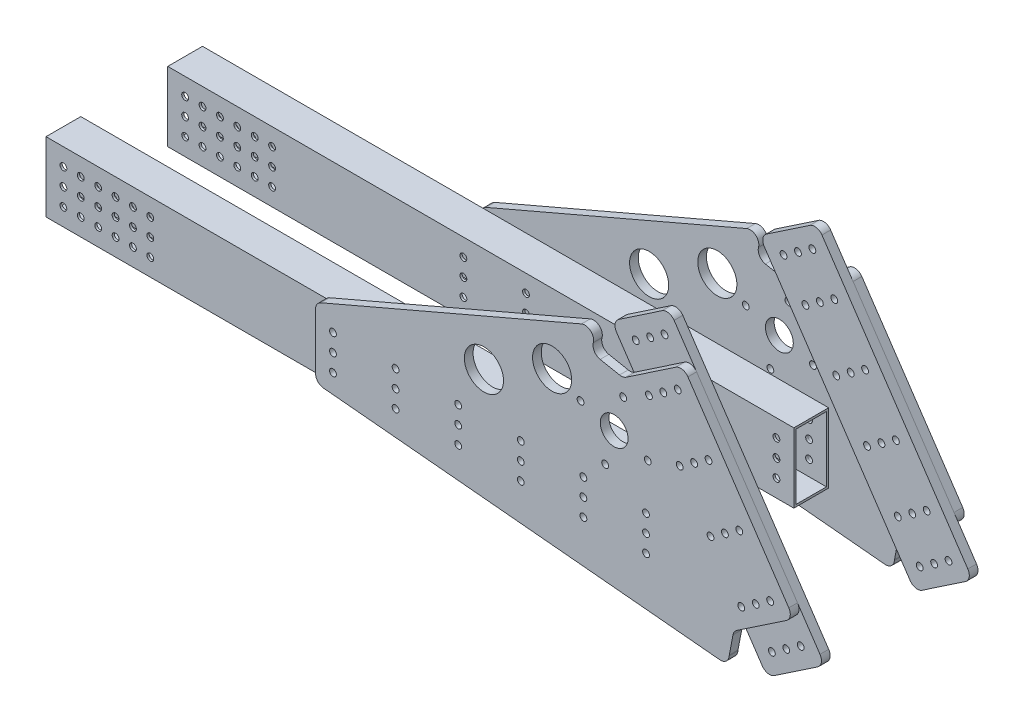
from build123d import *

# Parameters (mm, degrees)
BEARING_BLOCK_INTERFACE_PLATE_R = 2.4892
BOSS_EXTRUDE1_DEPTH             = 6.35
FILLET2_R                       = 6.35
PLATE_GB_R                      = 2.4892
PLATE_GB_R_2                    = 14.2875
PLATE_GB_R_3                    = 10.16
BOSS_EXTRUDE2_DEPTH             = 6.35
FILLET1_R                       = 6.35
TUBE_W                          = 457.2
TUBE_H                          = 50.8
BOSS_EXTRUDE3_DEPTH             = 25.4
SHELL2_T                        = -1.5875
TUBE_4_R                        = 2.4892
CUT_EXTRUDE2_DEPTH              = 773.869762832
SKETCH10_R                      = 2.4892
CUT_EXTRUDE3_DEPTH              = 774.104503156


with BuildPart() as part:
    # bearing block interface plate → Boss-Extrude1 (new body)
    with BuildSketch(Plane.XY.offset(57.15)):
        Polygon((529.051437766, 336.148394668), (571.166546451, 364.555394164), (684.794544436, 196.094959421), (642.679435751, 167.687959925), align=None)
        with Locations((646.106463048, 185.31848697)):
            Circle(BEARING_BLOCK_INTERFACE_PLATE_R, mode=Mode.SUBTRACT)
        with Locations((656.635240219, 192.420236844)):
            Circle(BEARING_BLOCK_INTERFACE_PLATE_R, mode=Mode.SUBTRACT)
        with Locations((667.164017391, 199.521986718)):
            Circle(BEARING_BLOCK_INTERFACE_PLATE_R, mode=Mode.SUBTRACT)
        with Locations((567.739519154, 346.924867119)):
            Circle(BEARING_BLOCK_INTERFACE_PLATE_R, mode=Mode.SUBTRACT)
        with Locations((557.210741982, 339.823117245)):
            Circle(BEARING_BLOCK_INTERFACE_PLATE_R, mode=Mode.SUBTRACT)
        with Locations((546.681964811, 332.721367371)):
            Circle(BEARING_BLOCK_INTERFACE_PLATE_R, mode=Mode.SUBTRACT)
        with Locations((562.660902028, 309.031618735)):
            Circle(BEARING_BLOCK_INTERFACE_PLATE_R, mode=Mode.SUBTRACT)
        with Locations((573.189679199, 316.133368609)):
            Circle(BEARING_BLOCK_INTERFACE_PLATE_R, mode=Mode.SUBTRACT)
        with Locations((583.71845637, 323.235118483)):
            Circle(BEARING_BLOCK_INTERFACE_PLATE_R, mode=Mode.SUBTRACT)
        with Locations((606.207330972, 289.893990773)):
            Circle(BEARING_BLOCK_INTERFACE_PLATE_R, mode=Mode.SUBTRACT)
        with Locations((595.6785538, 282.792240899)):
            Circle(BEARING_BLOCK_INTERFACE_PLATE_R, mode=Mode.SUBTRACT)
        with Locations((585.149776629, 275.690491025)):
            Circle(BEARING_BLOCK_INTERFACE_PLATE_R, mode=Mode.SUBTRACT)
        with Locations((628.696205573, 256.552863064)):
            Circle(BEARING_BLOCK_INTERFACE_PLATE_R, mode=Mode.SUBTRACT)
        with Locations((618.167428402, 249.45111319)):
            Circle(BEARING_BLOCK_INTERFACE_PLATE_R, mode=Mode.SUBTRACT)
        with Locations((607.63865123, 242.349363316)):
            Circle(BEARING_BLOCK_INTERFACE_PLATE_R, mode=Mode.SUBTRACT)
        with Locations((651.185080174, 223.211735354)):
            Circle(BEARING_BLOCK_INTERFACE_PLATE_R, mode=Mode.SUBTRACT)
        with Locations((640.656303003, 216.10998548)):
            Circle(BEARING_BLOCK_INTERFACE_PLATE_R, mode=Mode.SUBTRACT)
        with Locations((630.127525831, 209.008235606)):
            Circle(BEARING_BLOCK_INTERFACE_PLATE_R, mode=Mode.SUBTRACT)
    extrude(amount=-BOSS_EXTRUDE1_DEPTH)

    # Fillet2
    fillet2_edges = [part.edges().sort_by_distance(p)[0] for p in [
        (642.679435751, 167.687959925, 53.975),
        (571.166546451, 364.555394164, 53.975),
        (529.051437766, 336.148394668, 53.975),
        (684.794544436, 196.094959421, 53.975),
    ]]
    fillet(fillet2_edges, radius=FILLET2_R)


with BuildPart() as body_2:
    # plate+gb → Boss-Extrude2 (new body)
    with BuildSketch(Plane.XY.offset(63.5)):
        with BuildLine():
            Line((319.237342332, 246.126), (319.237342332, 195.326))
            Line((319.237342332, 195.326), (627.129512771, 166.477179286))
            ThreePointArc((627.129512771, 166.477179286), (622.555505171, 169.035259751), (621.371649855, 174.140532299))
            Line((621.371649855, 174.140532299), (623.889276442, 187.327918834))
            Line((623.889276442, 187.327918834), (624.075421765, 188.302952357))
            ThreePointArc((624.075421765, 188.302952357), (625.011743382, 190.608109349), (626.761896857, 192.376557749))
            Line((626.761896857, 192.376557749), (668.371747852, 220.44275663))
            Line((668.371747852, 220.44275663), (587.589343035, 340.207596955))
            Line((587.589343035, 340.207596955), (545.979492039, 312.141398074))
            ThreePointArc((545.979492039, 312.141398074), (543.684196204, 311.18115646), (541.196139608, 311.176541181))
            Line((541.196139608, 311.176541181), (540.222373002, 311.36920423))
            Line((540.222373002, 311.36920423), (527.052121603, 313.974983453))
            ThreePointArc((527.052121603, 313.974983453), (522.79804256, 316.926147758), (522.065562756, 322.05157775))
            ThreePointArc((522.065562756, 322.05157775), (520.117459336, 328.526714762), (513.437327672, 329.574735381))
            Line((513.437327672, 329.574735381), (319.237342332, 246.126))
        make_face()
        with Locations((630.127525831, 209.008235606)):
            Circle(PLATE_GB_R, mode=Mode.SUBTRACT)
        with Locations((530.703105922, 249.453949879)):
            Circle(PLATE_GB_R, mode=Mode.SUBTRACT)
        with Locations((640.656303003, 216.10998548)):
            Circle(PLATE_GB_R, mode=Mode.SUBTRACT)
        with Locations((651.185080174, 223.211735354)):
            Circle(PLATE_GB_R, mode=Mode.SUBTRACT)
        with Locations((607.63865123, 242.349363316)):
            Circle(PLATE_GB_R, mode=Mode.SUBTRACT)
        with Locations((618.167428402, 249.45111319)):
            Circle(PLATE_GB_R, mode=Mode.SUBTRACT)
        with Locations((442.183710758, 265.176)):
            Circle(PLATE_GB_R_2, mode=Mode.SUBTRACT)
        with Locations((491.957342332, 290.576)):
            Circle(PLATE_GB_R_2, mode=Mode.SUBTRACT)
        with Locations((537.277109667, 273.988465867)):
            Circle(PLATE_GB_R_3, mode=Mode.SUBTRACT)
        with Locations((561.811625655, 267.414462121)):
            Circle(PLATE_GB_R, mode=Mode.SUBTRACT)
        with Locations((512.74259368, 280.562469612)):
            Circle(PLATE_GB_R, mode=Mode.SUBTRACT)
        with Locations((628.696205573, 256.552863064)):
            Circle(PLATE_GB_R, mode=Mode.SUBTRACT)
        with Locations((585.149776629, 275.690491025)):
            Circle(PLATE_GB_R, mode=Mode.SUBTRACT)
        with Locations((595.6785538, 282.792240899)):
            Circle(PLATE_GB_R, mode=Mode.SUBTRACT)
        with Locations((606.207330972, 289.893990773)):
            Circle(PLATE_GB_R, mode=Mode.SUBTRACT)
        with Locations((543.851113413, 298.522981854)):
            Circle(PLATE_GB_R, mode=Mode.SUBTRACT)
        with Locations((562.660902028, 309.031618735)):
            Circle(PLATE_GB_R, mode=Mode.SUBTRACT)
        with Locations((573.189679199, 316.133368609)):
            Circle(PLATE_GB_R, mode=Mode.SUBTRACT)
        with Locations((583.71845637, 323.235118483)):
            Circle(PLATE_GB_R, mode=Mode.SUBTRACT)
    extrude(amount=-BOSS_EXTRUDE2_DEPTH)

    # Fillet1
    fillet1_edges = [body_2.edges().sort_by_distance(p)[0] for p in [
        (668.371747852, 220.44275663, 60.325),
        (587.589343035, 340.207596955, 60.325),
        (319.237342332, 246.126, 60.325),
        (319.237342332, 195.326, 60.325),
        (627.129512771, 166.477179286, 60.325),
    ]]
    fillet(fillet1_edges, radius=FILLET1_R)

    # Sketch10 → Cut-Extrude3 (cut, through all)
    with BuildSketch(Plane.XY.offset(63.5)):
        with Locations((469.097342332, 208.026)):
            Circle(SKETCH10_R)
        with Locations((423.377342332, 208.026)):
            Circle(SKETCH10_R)
        with Locations((377.657342332, 208.026)):
            Circle(SKETCH10_R)
        with Locations((331.937342332, 208.026)):
            Circle(SKETCH10_R)
        with Locations((331.937342332, 220.726)):
            Circle(SKETCH10_R)
        with Locations((377.657342332, 220.726)):
            Circle(SKETCH10_R)
        with Locations((423.377342332, 220.726)):
            Circle(SKETCH10_R)
        with Locations((469.097342332, 220.726)):
            Circle(SKETCH10_R)
        with Locations((514.817342332, 220.726)):
            Circle(SKETCH10_R)
        with Locations((514.817342332, 208.026)):
            Circle(SKETCH10_R)
        with Locations((560.537342332, 208.026)):
            Circle(SKETCH10_R)
        with Locations((560.537342332, 220.726)):
            Circle(SKETCH10_R)
        with Locations((560.537342332, 233.426)):
            Circle(SKETCH10_R)
        with Locations((514.817342332, 233.426)):
            Circle(SKETCH10_R)
        with Locations((469.097342332, 233.426)):
            Circle(SKETCH10_R)
        with Locations((423.377342332, 233.426)):
            Circle(SKETCH10_R)
        with Locations((377.657342332, 233.426)):
            Circle(SKETCH10_R)
        with Locations((331.937342332, 233.426)):
            Circle(SKETCH10_R)
    extrude(amount=-CUT_EXTRUDE3_DEPTH, mode=Mode.SUBTRACT)


with BuildPart() as body_3:
    # tube → Boss-Extrude3 (new body)
    with BuildSketch(Plane.XY.offset(57.15)):
        with Locations((344.637342332, 220.726)):
            Rectangle(TUBE_W, TUBE_H)
    extrude(amount=-BOSS_EXTRUDE3_DEPTH)

    # Shell2
    shell2_openings = [body_3.faces().sort_by_distance(p)[0] for p in [
        (573.237342332, 220.726, 44.45),
        (116.037342332, 220.726, 44.45),
    ]]
    offset(amount=SHELL2_T, openings=shell2_openings, kind=Kind.INTERSECTION)

    # tube<4> → Cut-Extrude2 (cut, through all)
    with BuildSketch(Plane.XY.offset(57.15)):
        with Locations((560.537342332, 220.726)):
            Circle(TUBE_4_R)
        with Locations((560.537342332, 208.026)):
            Circle(TUBE_4_R)
        with Locations((560.537342332, 233.426)):
            Circle(TUBE_4_R)
        with Locations((514.817342332, 208.026)):
            Circle(TUBE_4_R)
        with Locations((514.817342332, 220.726)):
            Circle(TUBE_4_R)
        with Locations((514.817342332, 233.426)):
            Circle(TUBE_4_R)
        with Locations((469.097342332, 208.026)):
            Circle(TUBE_4_R)
        with Locations((469.097342332, 220.726)):
            Circle(TUBE_4_R)
        with Locations((469.097342332, 233.426)):
            Circle(TUBE_4_R)
        with Locations((423.377342332, 208.026)):
            Circle(TUBE_4_R)
        with Locations((423.377342332, 220.726)):
            Circle(TUBE_4_R)
        with Locations((423.377342332, 233.426)):
            Circle(TUBE_4_R)
        with Locations((377.657342332, 208.026)):
            Circle(TUBE_4_R)
        with Locations((377.657342332, 220.726)):
            Circle(TUBE_4_R)
        with Locations((377.657342332, 233.426)):
            Circle(TUBE_4_R)
        with Locations((331.937342332, 208.026)):
            Circle(TUBE_4_R)
        with Locations((331.937342332, 220.726)):
            Circle(TUBE_4_R)
        with Locations((331.937342332, 233.426)):
            Circle(TUBE_4_R)
        with Locations((128.737342332, 220.726)):
            Circle(TUBE_4_R)
        with Locations((128.737342332, 208.026)):
            Circle(TUBE_4_R)
        with Locations((128.737342332, 233.426)):
            Circle(TUBE_4_R)
        with Locations((141.437342332, 220.726)):
            Circle(TUBE_4_R)
        with Locations((141.437342332, 208.026)):
            Circle(TUBE_4_R)
        with Locations((141.437342332, 233.426)):
            Circle(TUBE_4_R)
        with Locations((154.137342332, 220.726)):
            Circle(TUBE_4_R)
        with Locations((154.137342332, 208.026)):
            Circle(TUBE_4_R)
        with Locations((154.137342332, 233.426)):
            Circle(TUBE_4_R)
        with Locations((166.837342332, 220.726)):
            Circle(TUBE_4_R)
        with Locations((166.837342332, 208.026)):
            Circle(TUBE_4_R)
        with Locations((166.837342332, 233.426)):
            Circle(TUBE_4_R)
        with Locations((179.537342332, 220.726)):
            Circle(TUBE_4_R)
        with Locations((179.537342332, 208.026)):
            Circle(TUBE_4_R)
        with Locations((179.537342332, 233.426)):
            Circle(TUBE_4_R)
        with Locations((192.237342332, 220.726)):
            Circle(TUBE_4_R)
        with Locations((192.237342332, 208.026)):
            Circle(TUBE_4_R)
        with Locations((192.237342332, 233.426)):
            Circle(TUBE_4_R)
    extrude(amount=-CUT_EXTRUDE2_DEPTH, mode=Mode.SUBTRACT)


with BuildPart() as body_4:
    # Mirror1: mirrored copy
    add(body_2.part.mirror(Plane.XY))


with BuildPart() as body_5:
    # Mirror1 2: mirrored copy
    add(body_3.part.mirror(Plane.XY))


with BuildPart() as body_6:
    # Mirror1 3: mirrored copy
    add(part.part.mirror(Plane.XY))


solid = Compound([part.part, body_2.part, body_3.part, body_4.part, body_5.part, body_6.part])
